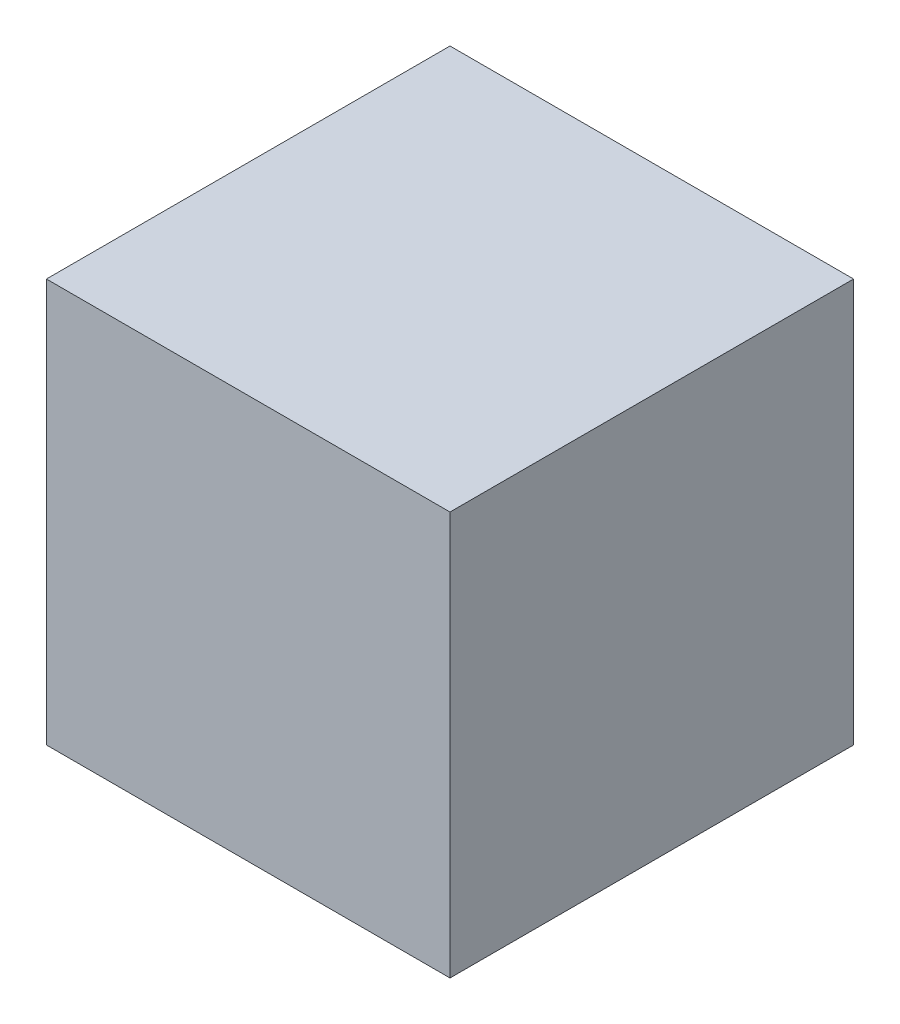
from build123d import *

# Parameters (mm, degrees)
SKETCH1_W           = 100
SKETCH1_H           = 100
BOSS_EXTRUDE1_DEPTH = 50


with BuildPart() as part:
    # Sketch1 → Boss-Extrude1 (new, symmetric)
    with BuildSketch(Plane.XY):
        Rectangle(SKETCH1_W, SKETCH1_H)
    extrude(amount=BOSS_EXTRUDE1_DEPTH, both=True)


solid = part.part
